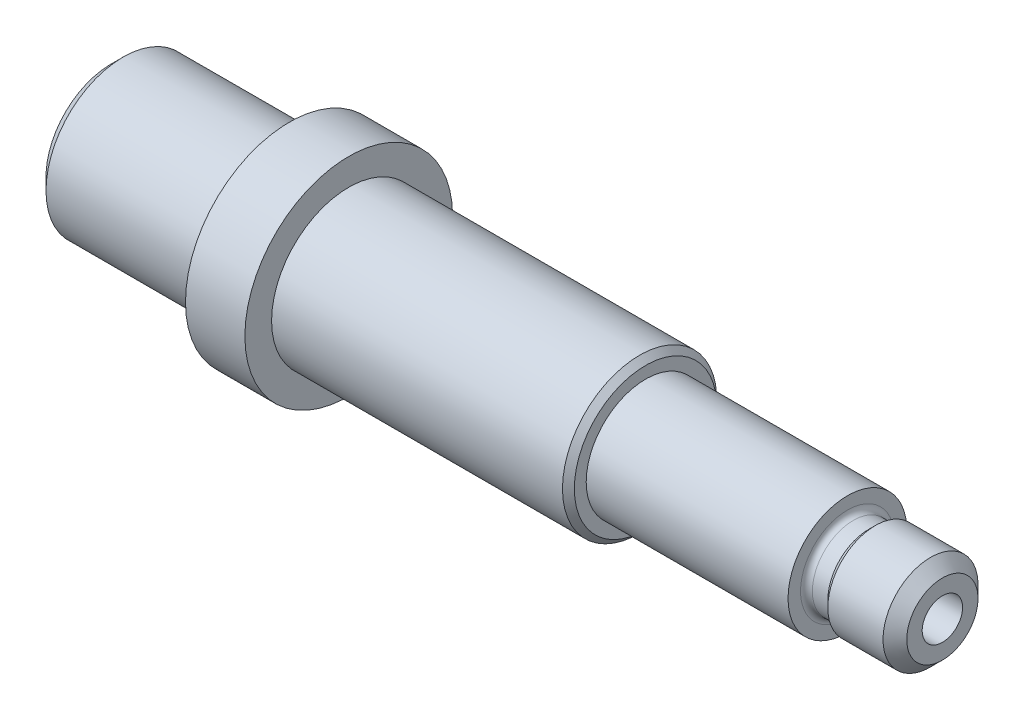
from build123d import *

# Parameters (mm, degrees)
M10X1_52_D            = 8.5
M10X1_52_DEPTH        = 37.5
M10X1_52_CSINK_D      = 11
M10X1_52_CSINK_ANGLE  = 90
M10X1_52_TIP          = 2.553657631
HOLE_WIZARD_M81_D     = 6.8
HOLE_WIZARD_M81_DEPTH = 30
HOLE_WIZARD_M81_TIP   = 2.042926105
SKETCH_6_W            = 2.5
SKETCH_6_H            = 1.1
CHAMFER_1_SIZE        = 2
CHAMFER_2_SIZE        = 1
CHAMFER_3_SIZE        = 2.2
FILLET_1_R            = 1


with BuildPart() as part:
    # Эскиз1 → Повернуть1 (revolve)
    with BuildSketch(Plane.XY, mode=Mode.PRIVATE) as revolve_1_sk:
        Polygon((0, 0), (0, 13), (30, 13), (30, 17.5), (40, 17.5), (40, 13), (90, 13), (90, 10), (124, 10), (124, 8), (140, 8), (140, 0), align=None)
    revolve(revolve_1_sk.sketch.rotate(Axis((-123.335902371, 0, 0), (1, 0, 0)), 90), axis=Axis((-123.335902371, 0, 0), (1, 0, 0)))

    # Отверстие обработанное метчиком M10x1.52
    with Locations(Plane.ZY):
        with Locations((0, 0)):
            CounterSinkHole(M10X1_52_D / 2, M10X1_52_CSINK_D / 2, depth=M10X1_52_DEPTH, counter_sink_angle=M10X1_52_CSINK_ANGLE)
            with Locations((0, 0, -(M10X1_52_DEPTH + M10X1_52_TIP / 2))):  # 118° drill point
                Cone(0, M10X1_52_D / 2, M10X1_52_TIP, mode=Mode.SUBTRACT)

    # Отверстие обработанное метчиком M81
    with Locations(Plane(origin=(140, 0, 0), x_dir=(0, 0, -1), z_dir=(1, 0, 0))):
        with Locations((0, 0)):
            Hole(HOLE_WIZARD_M81_D / 2, depth=HOLE_WIZARD_M81_DEPTH)
            with Locations((0, 0, -(HOLE_WIZARD_M81_DEPTH + HOLE_WIZARD_M81_TIP / 2))):  # 118° drill point
                Cone(0, HOLE_WIZARD_M81_D / 2, HOLE_WIZARD_M81_TIP, mode=Mode.SUBTRACT)

    # Эскиз6 → Вырез-Повернуть1 (revolve, cut)
    with BuildSketch(Plane.XY, mode=Mode.PRIVATE) as cut_revolve_1_sk:
        with Locations((125.25, 7.45)):
            Rectangle(SKETCH_6_W, SKETCH_6_H)
    revolve(cut_revolve_1_sk.sketch.rotate(Axis((0, 0, 0), (1, 0, 0)), 90), axis=Axis((0, 0, 0), (1, 0, 0)), mode=Mode.SUBTRACT)

    # Фаска1
    chamfer_1_edges = [part.edges().sort_by_distance(p)[0] for p in [
        (0, 0, -13),
        (140, 0, -8),
    ]]
    chamfer(chamfer_1_edges, length=CHAMFER_1_SIZE)

    # Фаска2
    chamfer_2_edges = [part.edges().sort_by_distance(p)[0] for p in [
        (90, 0, -13),
    ]]
    chamfer(chamfer_2_edges, length=CHAMFER_2_SIZE)

    # Фаска3
    # the kernel refuses this chamfer: 2.2 mm, written as the material it takes off along each edge
    with BuildSketch(Plane(origin=(126.5, 0, 0), x_dir=(0, 0, 1), z_dir=(0, 1, 0))) as chamfer_3_piece_1_section:
        Polygon((8 - CHAMFER_3_SIZE, 0), (8, CHAMFER_3_SIZE), (8, 0), align=None)
    chamfer_3_piece_1 = revolve(axis=Axis((126.5, 0, 0), (1, 0, 0)), mode=Mode.PRIVATE)
    chamfer_3_piece_1 = chamfer_3_piece_1 - Plane(origin=(128.148983784, 0, 0), x_dir=(0, 0, 1), z_dir=(-1, 0, 0)) * Cylinder(6.9, 32, mode=Mode.PRIVATE)
    add(chamfer_3_piece_1, mode=Mode.SUBTRACT)

    # Скругление1
    fillet_1_edges = [part.edges().sort_by_distance(p)[0] for p in [
        (124, 0, -6.9),
    ]]
    fillet(fillet_1_edges, radius=FILLET_1_R)


solid = part.part
